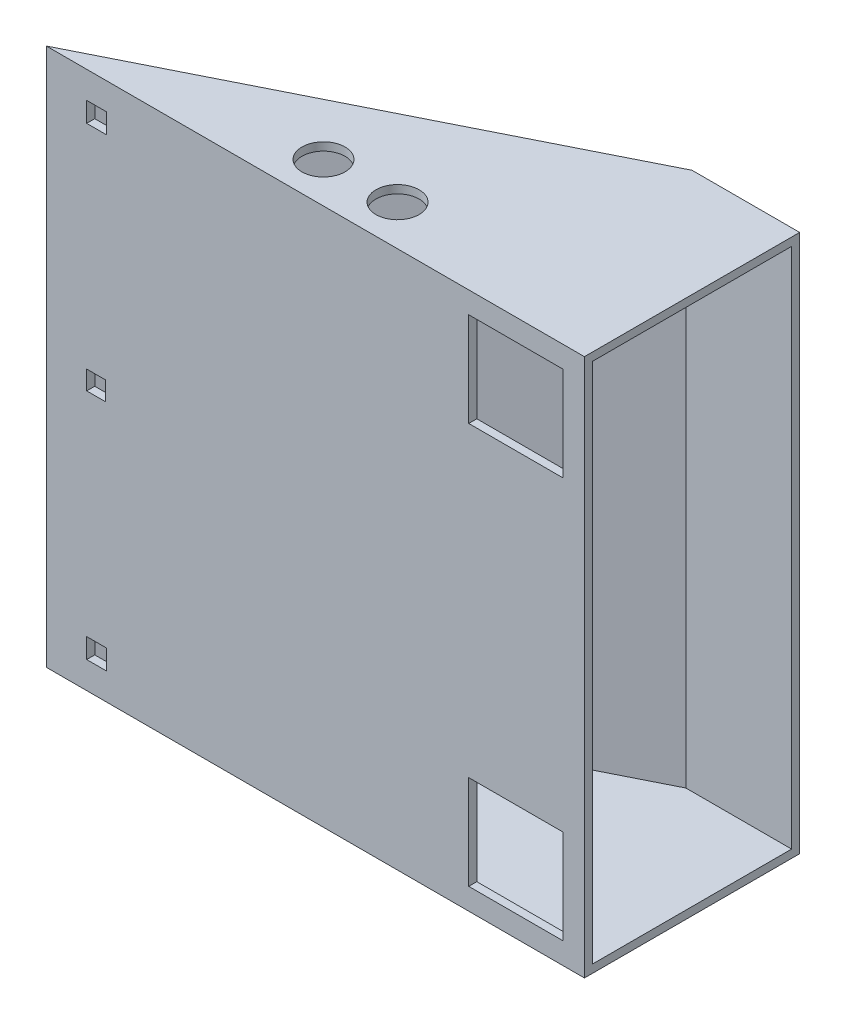
from build123d import *

# Parameters (mm, degrees)
SALIENTE_EXTRUIR2_DEPTH = 200
VACIADO2_T              = -3
CROQUIS6_R              = 8.2
CORTAR_EXTRUIR4_DEPTH   = 80
CROQUIS2_R              = 8.02
CORTAR_EXTRUIR5_DEPTH   = 3
CORTAR_EXTRUIR6_START   = -3
CROQUIS5_R              = 8.02
CORTAR_EXTRUIR6_DEPTH   = 3
CROQUIS7_W              = 7.4
CROQUIS7_H              = 7.4
CORTAR_EXTRUIR11_DEPTH  = 3
CROQUIS8_W              = 7.04
CROQUIS8_H              = 7.04
CORTAR_EXTRUIR12_DEPTH  = 3
CROQUIS9_W              = 35
CROQUIS9_H              = 35
CORTAR_EXTRUIR13_DEPTH  = 3


with BuildPart() as part:
    # Croquis1 → Saliente-Extruir2 (new body)
    with BuildSketch(Plane(origin=(0, 0, 0), x_dir=(1, 0, 0), z_dir=(0, 1, 0))):
        Polygon((0, 0), (200, 0), (200, 80), (160, 80), align=None)
    extrude(amount=SALIENTE_EXTRUIR2_DEPTH)

    # Vaciado2
    vaciado2_openings = [part.faces().sort_by_distance(p)[0] for p in [
        (200, 100, -40),
    ]]
    offset(amount=VACIADO2_T, openings=vaciado2_openings, kind=Kind.INTERSECTION)

    # Croquis6 → Cortar-Extruir4 (cut)
    with BuildSketch(Plane(origin=(0, 0, 0), x_dir=(0, 0, -1), z_dir=(1, 0, 0))):
        with Locations((30, 88.575)):
            Circle(CROQUIS6_R)
        with Locations((30, 111.425)):
            Circle(CROQUIS6_R)
    extrude(amount=CORTAR_EXTRUIR4_DEPTH, mode=Mode.SUBTRACT)

    # Croquis2 → Cortar-Extruir5 (cut)
    with BuildSketch(Plane(origin=(0, 200, 0), x_dir=(1, 0, 0), z_dir=(0, 1, 0))):
        with Locations((88.011571484, 15)):
            Circle(CROQUIS2_R)
        with Locations((115.531571484, 15)):
            Circle(CROQUIS2_R)
    extrude(amount=-CORTAR_EXTRUIR5_DEPTH, mode=Mode.SUBTRACT)

    # Croquis5 → Cortar-Extruir6 (cut)
    with BuildSketch(Plane.XZ.offset(CORTAR_EXTRUIR6_START)):
        with Locations((88.011571484, -15)):
            Circle(CROQUIS5_R)
        with Locations((115.531571484, -15)):
            Circle(CROQUIS5_R)
    extrude(amount=CORTAR_EXTRUIR6_DEPTH, mode=Mode.SUBTRACT)

    # Croquis7 → Cortar-Extruir11 (cut)
    with BuildSketch(Plane.XY):
        with Locations((18.7, 13.7)):
            Rectangle(CROQUIS7_W, CROQUIS7_H)
    cortar_extruir11 = extrude(amount=-CORTAR_EXTRUIR11_DEPTH, mode=Mode.SUBTRACT)

    # Simetría5: Cortar-Extruir11 across plane
    add(cortar_extruir11.mirror(Plane.ZX.offset(100)), mode=Mode.SUBTRACT)

    # Croquis8 → Cortar-Extruir12 (cut)
    with BuildSketch(Plane.XY):
        with Locations((18.52, 100)):
            Rectangle(CROQUIS8_W, CROQUIS8_H)
    extrude(amount=-CORTAR_EXTRUIR12_DEPTH, mode=Mode.SUBTRACT)

    # Croquis9 → Cortar-Extruir13 (cut)
    with BuildSketch(Plane.XY):
        with Locations((174.5, 174.5)):
            Rectangle(CROQUIS9_W, CROQUIS9_H)
    cortar_extruir13 = extrude(amount=-CORTAR_EXTRUIR13_DEPTH, mode=Mode.SUBTRACT)

    # Simetría6: Cortar-Extruir13 across plane
    add(cortar_extruir13.mirror(Plane.ZX.offset(100)), mode=Mode.SUBTRACT)


solid = part.part
